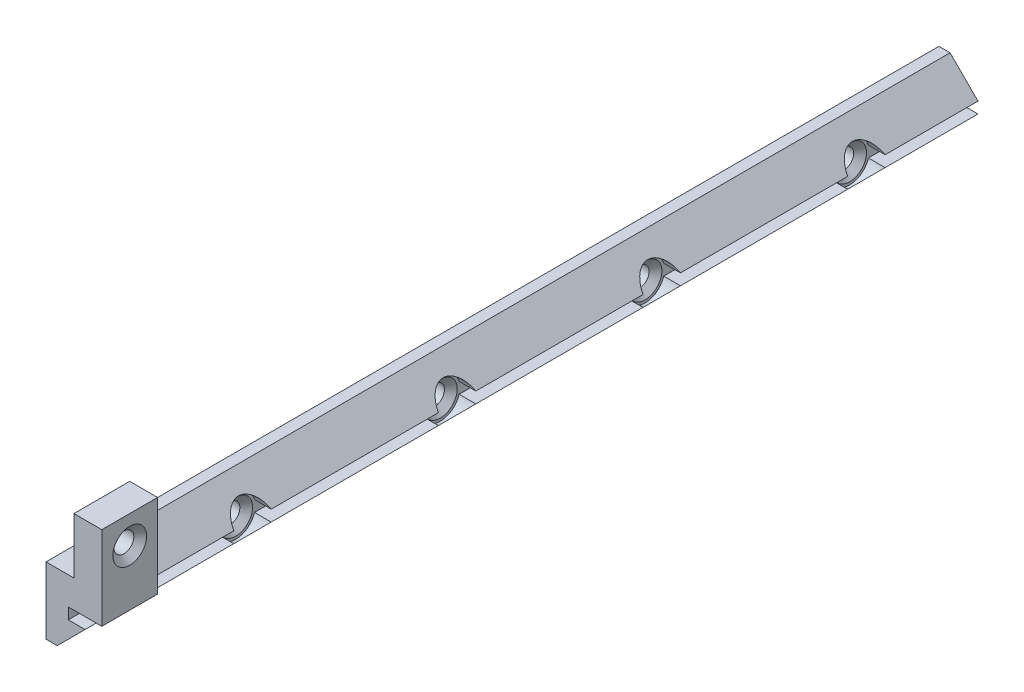
from build123d import *

# Parameters (mm, degrees)
BOSS_EXTRUDE1_DEPTH                               = 75
SKETCH5_R                                         = 1.75
CUT_EXTRUDE1_DEPTH                                = 2
CSK_FOR_0_FLAT_HEAD_MACHINE_SCREW_100_D           = 1.778
CSK_FOR_0_FLAT_HEAD_MACHINE_SCREW_100_DEPTH       = 3.302
CSK_FOR_0_FLAT_HEAD_MACHINE_SCREW_100_CSINK_D     = 3.0226
CSK_FOR_0_FLAT_HEAD_MACHINE_SCREW_100_CSINK_ANGLE = 100
CSK_FOR_0_FLAT_HEAD_MACHINE_SCREW_100_TIP         = 0.53416509
CHAMFER1_SIZE                                     = 3
BOSS_EXTRUDE2_DEPTH                               = 5
CHAMFER2_SIZE                                     = 3
CSK_FOR_0_FLAT_HEAD_MACHINE_SCREW_2_D             = 1.778
CSK_FOR_0_FLAT_HEAD_MACHINE_SCREW_2_DEPTH         = 3.302
CSK_FOR_0_FLAT_HEAD_MACHINE_SCREW_2_CSINK_D       = 3.0226
CSK_FOR_0_FLAT_HEAD_MACHINE_SCREW_2_CSINK_ANGLE   = 100
CSK_FOR_0_FLAT_HEAD_MACHINE_SCREW_2_TIP           = 0.53416509


with BuildPart() as part:
    # Sketch1 → Boss-Extrude1 (new body)
    with BuildSketch(Plane.XY):
        Polygon((-2, -3), (2, -3), (2, -0.5), (0, -0.5), (0, 0.5), (2, 0.5), (2, 3), (-2, 3), align=None)
    extrude(amount=BOSS_EXTRUDE1_DEPTH)

    # Sketch5 → Cut-Extrude1 (cut)
    with BuildSketch(Plane(origin=(2, 0, 0), x_dir=(0, 0, -1), z_dir=(1, 0, 0))):
        with Locations((-65, 0)):
            Circle(SKETCH5_R)
        with Locations((-46.66667, 0)):
            Circle(SKETCH5_R)
        with Locations((-28.33334, 0)):
            Circle(SKETCH5_R)
        with Locations((-10.00001, 0)):
            Circle(SKETCH5_R)
    extrude(amount=-CUT_EXTRUDE1_DEPTH, mode=Mode.SUBTRACT)

    # CSK for _0 Flat Head Machine Screw _100
    with Locations(Plane(origin=(0, 0, 0), x_dir=(0, 0, -1), z_dir=(1, 0, 0))):
        with Locations((-65, 0), (-10.00001, 0), (-46.66667, 0), (-28.33334, 0)):
            CounterSinkHole(CSK_FOR_0_FLAT_HEAD_MACHINE_SCREW_100_D / 2, CSK_FOR_0_FLAT_HEAD_MACHINE_SCREW_100_CSINK_D / 2, depth=CSK_FOR_0_FLAT_HEAD_MACHINE_SCREW_100_DEPTH, counter_sink_angle=CSK_FOR_0_FLAT_HEAD_MACHINE_SCREW_100_CSINK_ANGLE)
            with Locations((0, 0, -(CSK_FOR_0_FLAT_HEAD_MACHINE_SCREW_100_DEPTH + CSK_FOR_0_FLAT_HEAD_MACHINE_SCREW_100_TIP / 2))):  # 118° drill point
                Cone(0, CSK_FOR_0_FLAT_HEAD_MACHINE_SCREW_100_D / 2, CSK_FOR_0_FLAT_HEAD_MACHINE_SCREW_100_TIP, mode=Mode.SUBTRACT)

    # Chamfer1
    # the kernel refuses this chamfer: 3 mm, written as the material it takes off along each edge
    with BuildSketch(Plane(origin=(2, -3, -7.715048964), x_dir=(-0.9996219169112968, -0.027495876610586348, 0), z_dir=(0, 0, 1))) as chamfer1_piece_1:
        Polygon((CHAMFER1_SIZE * 0.999621916911, -CHAMFER1_SIZE * 0.0274958766106), (-CHAMFER1_SIZE * 0.0274958766106, -CHAMFER1_SIZE * 0.999621916911), (0, 0), align=None)
    extrude(amount=90.430097928, mode=Mode.SUBTRACT)
    with BuildSketch(Plane(origin=(2, 3, -7.715048964), x_dir=(-0.9996219169112968, 0.027495876610586348, 0), z_dir=(0, 0, 1))) as chamfer1_piece_2:
        Polygon((CHAMFER1_SIZE * 0.999621916911, CHAMFER1_SIZE * 0.0274958766106), (-CHAMFER1_SIZE * 0.0274958766106, CHAMFER1_SIZE * 0.999621916911), (0, 0), align=None)
    extrude(amount=90.430097928, mode=Mode.SUBTRACT)

    # Sketch6 → Boss-Extrude2 (add)
    with BuildSketch(Plane.XY.offset(75)):
        Polygon((0.5, 8), (3, 8), (3, 0.5), (0, 0.5), (0, -0.5), (2, -0.5), (2, -3), (-2, -3), (-2, 3), (0.5, 3), align=None)
    extrude(amount=BOSS_EXTRUDE2_DEPTH)

    # Chamfer2
    # the kernel refuses this chamfer: 3 mm, written as the material it takes off along each edge
    with BuildSketch(Plane(origin=(2, -3, 67.284951036), x_dir=(-0.9996219169112968, -0.027495876610586348, 0), z_dir=(0, 0, 1))) as chamfer2_piece_1:
        Polygon((CHAMFER2_SIZE * 0.999621916911, -CHAMFER2_SIZE * 0.0274958766106), (-CHAMFER2_SIZE * 0.0274958766106, -CHAMFER2_SIZE * 0.999621916911), (0, 0), align=None)
    extrude(amount=20.430097928, mode=Mode.SUBTRACT)

    # CSK for _0 Flat Head Machine Screw _ 2
    with Locations(Plane(origin=(3, 0, 0), x_dir=(0, 0, -1), z_dir=(1, 0, 0))):
        with Locations((-77.5, 5.5)):
            CounterSinkHole(CSK_FOR_0_FLAT_HEAD_MACHINE_SCREW_2_D / 2, CSK_FOR_0_FLAT_HEAD_MACHINE_SCREW_2_CSINK_D / 2, depth=CSK_FOR_0_FLAT_HEAD_MACHINE_SCREW_2_DEPTH, counter_sink_angle=CSK_FOR_0_FLAT_HEAD_MACHINE_SCREW_2_CSINK_ANGLE)
            with Locations((0, 0, -(CSK_FOR_0_FLAT_HEAD_MACHINE_SCREW_2_DEPTH + CSK_FOR_0_FLAT_HEAD_MACHINE_SCREW_2_TIP / 2))):  # 118° drill point
                Cone(0, CSK_FOR_0_FLAT_HEAD_MACHINE_SCREW_2_D / 2, CSK_FOR_0_FLAT_HEAD_MACHINE_SCREW_2_TIP, mode=Mode.SUBTRACT)


solid = part.part
